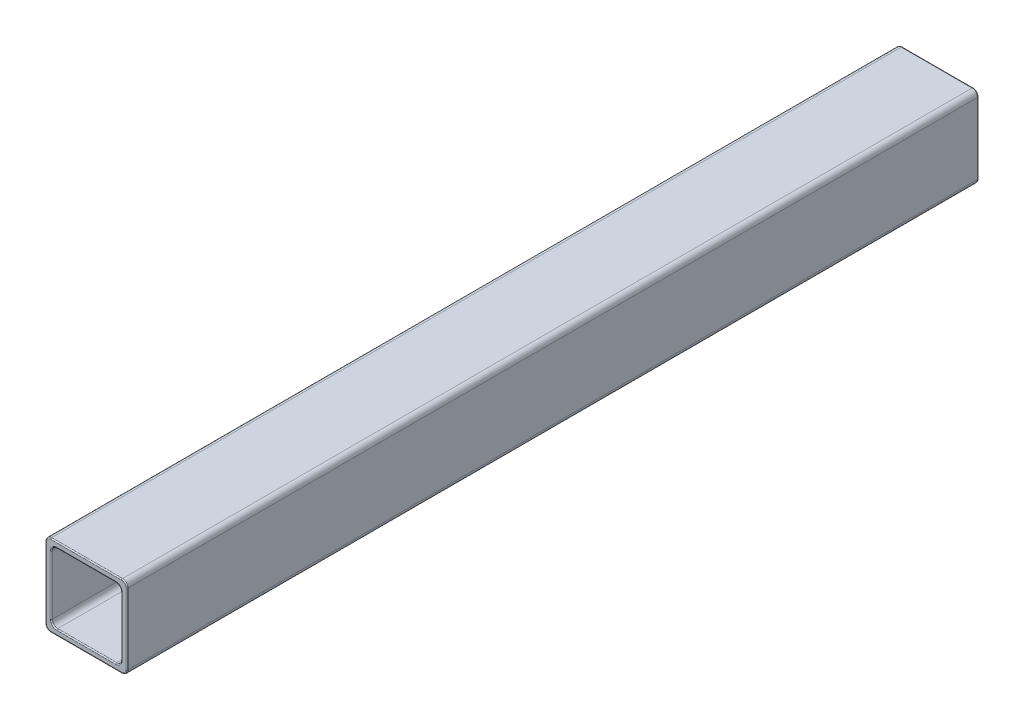
from build123d import *

# Parameters (mm, degrees)
BOSS_EXTRUDE1_DEPTH = 397
FILLET1_R           = 0.5


with BuildPart() as part:
    # Sketch1 → Boss-Extrude1 (new body)
    with BuildSketch(Plane.XY):
        with BuildLine():
            Line((2.54, 0), (35.56, 0))
            ThreePointArc((35.56, 0), (37.356051224, -0.743948776), (38.1, -2.54))
            Line((38.1, -2.54), (38.1, -35.56))
            ThreePointArc((38.1, -35.56), (37.356051224, -37.356051224), (35.56, -38.1))
            Line((35.56, -38.1), (2.54, -38.1))
            ThreePointArc((2.54, -38.1), (0.743948776, -37.356051224), (0, -35.56))
            Line((0, -35.56), (0, -2.54))
            ThreePointArc((0, -2.54), (0.743948776, -0.743948776), (2.54, 0))
        make_face()
        with BuildLine():
            Line((5.3086, -2.7686), (32.7914, -2.7686))
            ThreePointArc((32.7914, -2.7686), (34.587451224, -3.512548776), (35.3314, -5.3086))
            Line((35.3314, -5.3086), (35.3314, -32.7914))
            ThreePointArc((35.3314, -32.7914), (34.587451224, -34.587451224), (32.7914, -35.3314))
            Line((32.7914, -35.3314), (5.3086, -35.3314))
            ThreePointArc((5.3086, -35.3314), (3.512548776, -34.587451224), (2.7686, -32.7914))
            Line((2.7686, -32.7914), (2.7686, -5.3086))
            ThreePointArc((2.7686, -5.3086), (3.512548776, -3.512548776), (5.3086, -2.7686))
        make_face(mode=Mode.SUBTRACT)
    extrude(amount=BOSS_EXTRUDE1_DEPTH)

    # Fillet1
    fillet1_edges = [part.edges().sort_by_distance(p)[0] for p in [
        (34.587451224, -3.512548776, 397),
        (35.3314, -19.05, 397),
        (34.587451224, -34.587451224, 397),
        (19.05, -35.3314, 397),
        (3.512548776, -34.587451224, 397),
        (2.7686, -19.05, 397),
        (3.512548776, -3.512548776, 397),
        (37.356051224, -0.743948776, 397),
        (38.1, -19.05, 397),
        (37.356051224, -37.356051224, 397),
        (19.05, -38.1, 397),
        (0.743948776, -37.356051224, 397),
        (0, -19.05, 397),
        (0.743948776, -0.743948776, 397),
        (37.356051224, -0.743948776, 0),
        (38.1, -19.05, 0),
        (37.356051224, -37.356051224, 0),
        (19.05, -38.1, 0),
        (0.743948776, -37.356051224, 0),
        (0, -19.05, 0),
        (0.743948776, -0.743948776, 0),
        (34.587451224, -3.512548776, 0),
        (35.3314, -19.05, 0),
        (34.587451224, -34.587451224, 0),
        (19.05, -35.3314, 0),
        (3.512548776, -34.587451224, 0),
        (2.7686, -19.05, 0),
        (3.512548776, -3.512548776, 0),
        (19.05, -2.7686, 397),
        (19.05, 0, 397),
        (19.05, 0, 0),
        (19.05, -2.7686, 0),
    ]]
    fillet(fillet1_edges, radius=FILLET1_R)


solid = part.part
